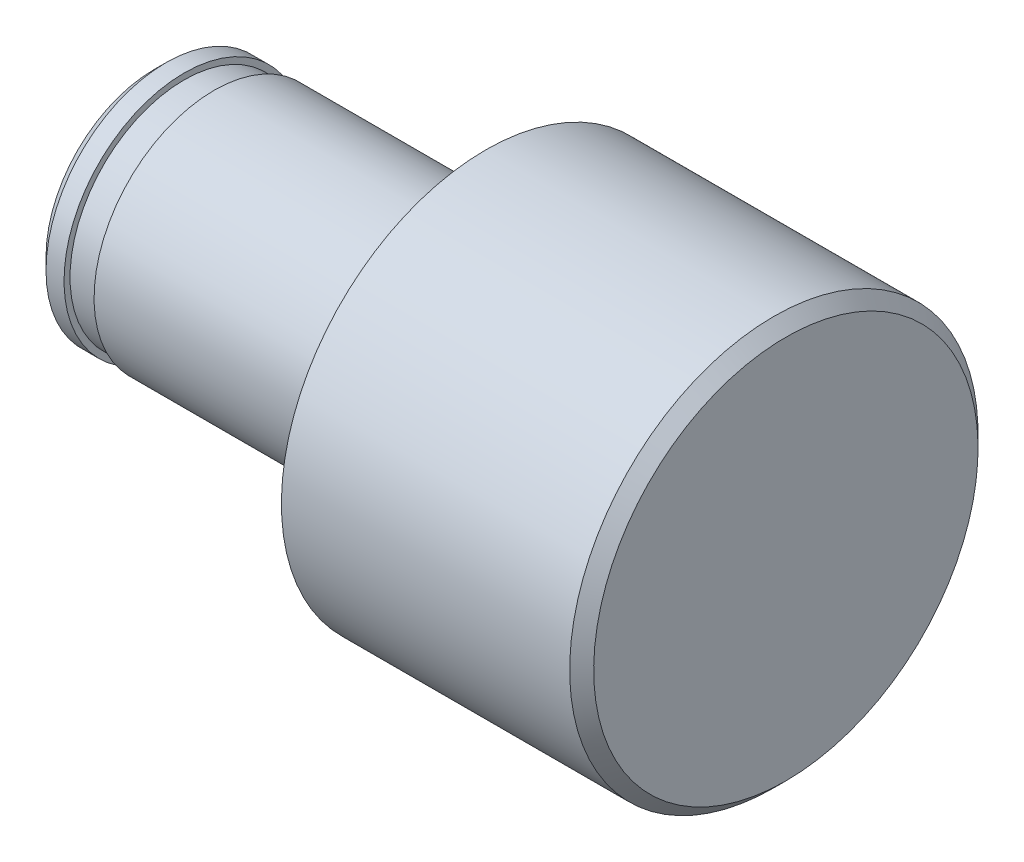
from build123d import *

# Parameters (mm, degrees)
FASE1_SIZE = 0.2


with BuildPart() as part:
    # Skizze2 → Rotation1 (revolve)
    with BuildSketch(Plane.XY):
        Polygon((3.956451613, 0), (-6.563548387, 0), (-6.563548387, 2), (-6.063548387, 2), (-6.063548387, 1.9), (-5.563548387, 1.9), (-5.563548387, 2), (-1.043548387, 2), (-1.043548387, 3.4), (3.956451613, 3.4), align=None)
    revolve(axis=Axis((3.956451613, 0, 0), (-1, 0, 0)))

    # Fase1
    fase1_edges = [part.edges().sort_by_distance(p)[0] for p in [
        (3.956451613, -3.4, 0),
        (-6.563548387, -2, 0),
    ]]
    chamfer(fase1_edges, length=FASE1_SIZE)


solid = part.part
